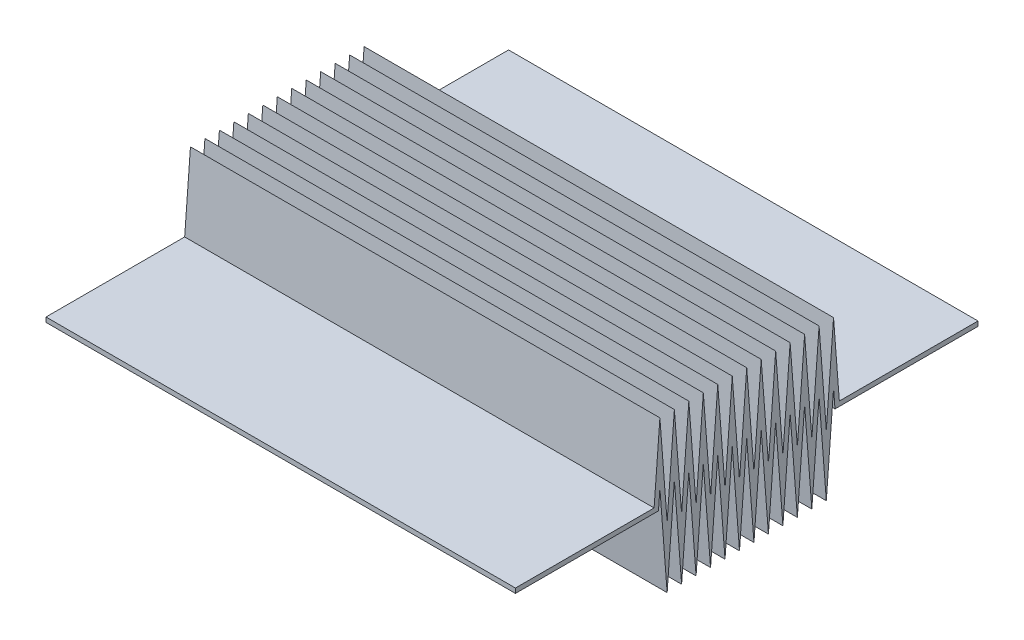
from build123d import *

# Parameters (mm, degrees)
EXTRUDE_THIN1_DEPTH = 25


with BuildPart() as part:
    # Sketch3 → Extrude-Thin1 (new, symmetric)
    with BuildSketch(Plane(origin=(0, 0, 0), x_dir=(0, 0, -1), z_dir=(1, 0, 0))):
        Polygon((0, 4.75), (15.2314753, 4.75), (15.385319101, 6.746316827), (16.155957303, -3.253683173), (16.926595506, 6.746316827), (17.697233708, -3.253683173), (18.46787191, 6.746316827), (19.238510113, -3.253683173), (20.009148315, 6.746316827), (20.779786517, -3.253683173), (21.55042472, 6.746316827), (22.321062922, -3.253683173), (23.091701124, 6.746316827), (23.862339327, -3.253683173), (24.632977529, 6.746316827), (25.403615731, -3.253683173), (26.174253934, 6.746316827), (26.944892136, -3.253683173), (27.715530338, 6.746316827), (28.486168541, -3.253683173), (29.256806743, 6.746316827), (30.027444945, -3.253683173), (30.798083148, 6.746316827), (31.56872135, -3.253683173), (32.339359552, 6.746316827), (33.109997755, -3.253683173), (33.880635957, 6.746316827), (34.034479758, 4.75), (49.265955058, 4.75), (49.265955058, 5.25), (34.497430358, 5.25), (33.880635957, 13.253683173), (33.109997755, 3.253683173), (32.339359552, 13.253683173), (31.56872135, 3.253683173), (30.798083148, 13.253683173), (30.027444945, 3.253683173), (29.256806743, 13.253683173), (28.486168541, 3.253683173), (27.715530338, 13.253683173), (26.944892136, 3.253683173), (26.174253934, 13.253683173), (25.403615731, 3.253683173), (24.632977529, 13.253683173), (23.862339327, 3.253683173), (23.091701124, 13.253683173), (22.321062922, 3.253683173), (21.55042472, 13.253683173), (20.779786517, 3.253683173), (20.009148315, 13.253683173), (19.238510113, 3.253683173), (18.46787191, 13.253683173), (17.697233708, 3.253683173), (16.926595506, 13.253683173), (16.155957303, 3.253683173), (15.385319101, 13.253683173), (14.7685247, 5.25), (0, 5.25), align=None)
    extrude(amount=EXTRUDE_THIN1_DEPTH, both=True)


solid = part.part
